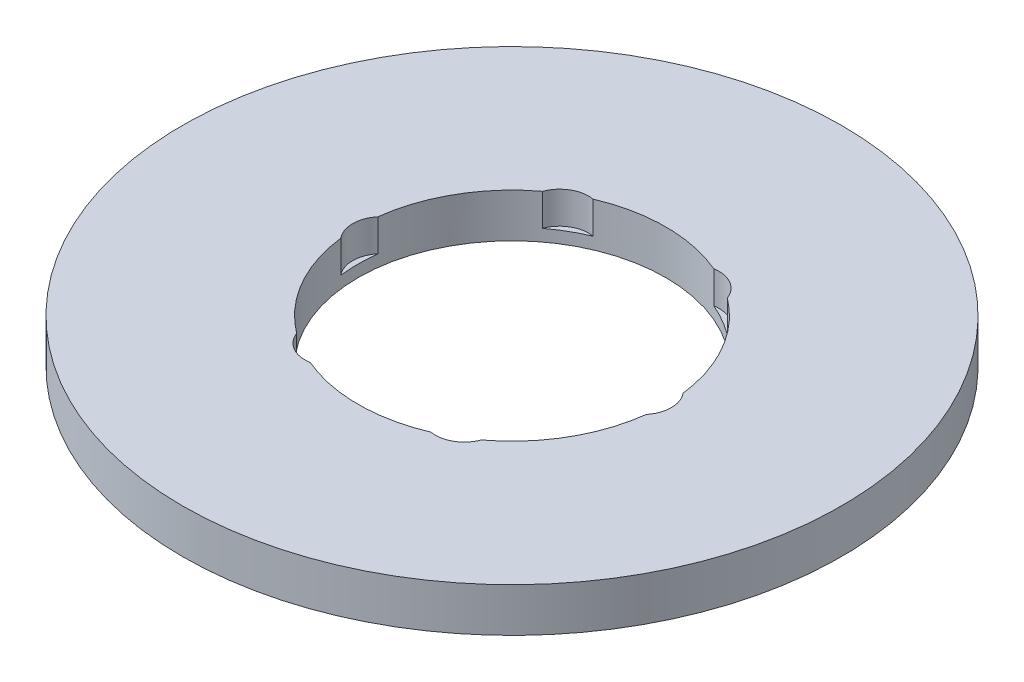
from build123d import *

# Parameters (mm, degrees)
SKETCH1_R           = 37.5
BOSS_EXTRUDE1_DEPTH = 5
SKETCH2_R           = 17.5
CUT_EXTRUDE1_DEPTH  = 54.268189382
SKETCH3_R           = 3.298387341
CUT_EXTRUDE2_DEPTH  = 3.650405133
CIRPATTERN1_COUNT   = 6


with BuildPart() as part:
    # Sketch1 → Boss-Extrude1 (new body)
    with BuildSketch(Plane(origin=(0, 0, 0), x_dir=(1, 0, 0), z_dir=(0, 1, 0))):
        Circle(SKETCH1_R)
    extrude(amount=BOSS_EXTRUDE1_DEPTH)

    # Sketch2 → Cut-Extrude1 (cut, through all)
    with BuildSketch(Plane(origin=(0, 0, 0), x_dir=(1, 0, 0), z_dir=(0, 1, 0))):
        Circle(SKETCH2_R)
    extrude(amount=CUT_EXTRUDE1_DEPTH, mode=Mode.SUBTRACT)

    # Sketch3 → Cut-Extrude2 (cut)
    with BuildSketch(Plane(origin=(0, 5, 0), x_dir=(1, 0, 0), z_dir=(0, 1, 0))):
        with Locations((-14.833320184, 0)):
            Circle(SKETCH3_R)
    cut_extrude2 = extrude(amount=-CUT_EXTRUDE2_DEPTH, mode=Mode.SUBTRACT)

    # CirPattern1: Cut-Extrude2 ×6 about axis
    cirpattern1_axis = Axis((0, 0, 0), (0, 1, 0))
    for i in range(1, CIRPATTERN1_COUNT):
        add(cut_extrude2.rotate(cirpattern1_axis, i * 360 / CIRPATTERN1_COUNT), mode=Mode.SUBTRACT)


solid = part.part
